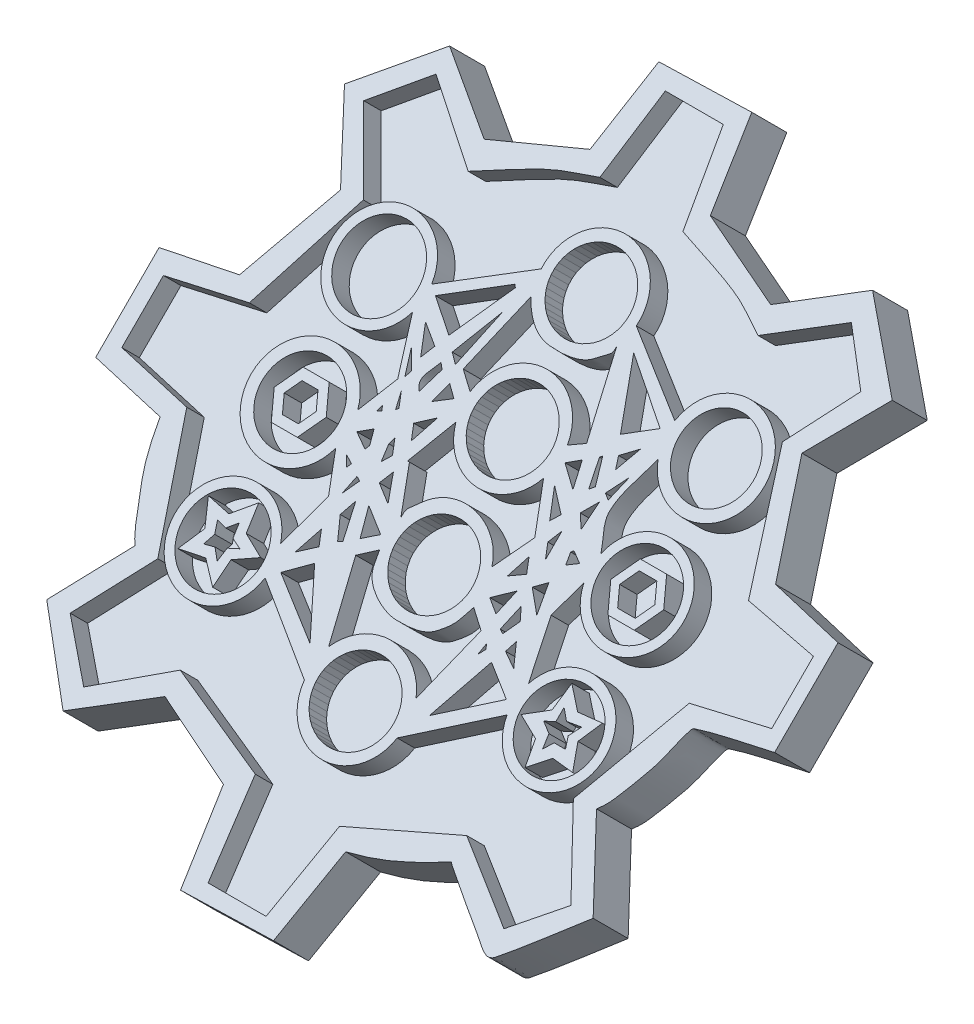
from build123d import *

# Parameters (mm, degrees)
SKETCH3_R                       = 19.05
BOSS_EXTRUDE1_DEPTH             = 6.35
BOSS_EXTRUDE2_REACH             = 37.728
SKETCH2_R                       = 5.715
BOSS_EXTRUDE2_DIRECTION_2_DEPTH = 3.175
BOSS_EXTRUDE3_DEPTH             = 3.175
SKETCH5_3_R                     = 4.970568882
SKETCH5_3_R_2                   = 4.805652839
SKETCH5_3_R_3                   = 4.855605282
SKETCH5_3_R_4                   = 4.870988111
SKETCH5_3_R_5                   = 4.809360952
SKETCH5_3_R_6                   = 5.038332607
BOSS_EXTRUDE4_DEPTH             = 6.35


with BuildPart() as part:
    # Sketch3 → Boss-Extrude1 (new body)
    with BuildSketch(Plane(origin=(0, 0, 0), x_dir=(1, 0, 0), z_dir=(0, 0.7071067811865464, 0.7071067811865488))):
        Circle(SKETCH3_R)
    extrude(amount=BOSS_EXTRUDE1_DEPTH)

    # Boss-Extrude2: up to this plane
    boss_extrude2_end = Plane(origin=(0, 0, 0), z_dir=(0, 0.7071067811865464, 0.7071067811865488))
    # Sketch2 → Boss-Extrude2 (add, up to the surface)
    with BuildSketch(Plane(origin=(0, -6.35, 0), x_dir=(1, 0, 0), z_dir=(0, 1, 0)), mode=Mode.PRIVATE) as boss_extrude2_sk1:
        Circle(SKETCH2_R)
    boss_extrude2_tool1 = split(extrude(boss_extrude2_sk1.sketch, amount=BOSS_EXTRUDE2_REACH, mode=Mode.PRIVATE), bisect_by=boss_extrude2_end, keep=Keep.BOTH, mode=Mode.PRIVATE)
    add(boss_extrude2_tool1.solids().sort_by_distance((0, -6.35, 0))[0])

    # Sketch2 → Boss-Extrude2 direction 2 (add)
    with BuildSketch(Plane(origin=(0, -6.35, 0), x_dir=(1, 0, 0), z_dir=(0, 1, 0))):
        Circle(SKETCH2_R)
    extrude(amount=-BOSS_EXTRUDE2_DIRECTION_2_DEPTH)

    # Sketch5 → Boss-Extrude3 (add)
    with BuildSketch(Plane(origin=(0, 4.490128061, 4.490128061), x_dir=(1, 0, 0), z_dir=(0, 0.7071067811865465, 0.7071067811865487))):
        with BuildLine():
            Line((5.279739912, -44.344196774), (7.279739912, -34.094196774))
            add(Edge.make_bspline(
                [(7.279739912, -34.094196774), (11.584757001, -33.233193357), (14.144722894, -32.036705283), (18.029739912, -30.094196774)],
                knots=[0, 0, 0, 0, 1, 1, 1, 1], degree=3))
            add(Edge.make_bspline(
                [(18.029739912, -30.094196774), (18.113073245, -30.177530108), (18.182843633, -30.277114735), (18.279739912, -30.344196774), (20.235461571, -31.698157923), (22.535311856, -33.297818538), (24.529739912, -34.594196774), (25.188895017, -35.022647593), (25.783918217, -35.595589543), (26.529739912, -35.844196774), (26.855700032, -35.952850148), (27.279313446, -35.829445878), (27.529739912, -35.594196774), (30.064023137, -33.213506472), (32.363073245, -30.594196774), (34.779739912, -28.094196774)],
                knots=[0, 0, 0, 0, 1, 1, 1, 2, 2, 2, 3, 3, 3, 4, 4, 4, 5, 5, 5, 5], degree=3))
            Line((34.779739912, -28.094196774), (29.029739912, -19.344196774))
            add(Edge.make_bspline(
                [(29.029739912, -19.344196774), (29.535637842, -18.838298844), (29.970385304, -18.21290599), (30.279739912, -17.594196774), (30.979938296, -16.193800005), (31.705875704, -14.800928994), (32.279739912, -13.344196774), (32.791745788, -12.044489549), (33.046816761, -10.654988184), (33.529739912, -9.344196774), (33.633611445, -9.062259756), (33.739170176, -8.670662494), (34.029739912, -8.594196774), (36.985300351, -7.816417712), (40.029739912, -7.427530108), (43.029739912, -6.844196774)],
                knots=[0, 0, 0, 0, 1, 1, 1, 2, 2, 2, 3, 3, 3, 4, 4, 4, 5, 5, 5, 5], degree=3))
            Line((43.029739912, -6.844196774), (43.029739912, 4.655803226))
            Line((43.029739912, 4.655803226), (33.779739912, 6.405803226))
            Line((33.779739912, 6.405803226), (29.029739912, 17.905803226))
            Line((29.029739912, 17.905803226), (34.779739912, 26.155803226))
            Line((34.779739912, 26.155803226), (26.779739912, 33.905803226))
            Line((26.779739912, 33.905803226), (17.779739912, 28.155803226))
            Line((17.779739912, 28.155803226), (7.029739912, 32.405803226))
            Line((7.029739912, 32.405803226), (5.279739912, 42.405803226))
            Line((5.279739912, 42.405803226), (-6.470260088, 42.155803226))
            Line((-6.470260088, 42.155803226), (-8.220260088, 32.155803226))
            Line((-8.220260088, 32.155803226), (-18.970260088, 28.155803226))
            Line((-18.970260088, 28.155803226), (-27.470260088, 33.905803226))
            Line((-27.470260088, 33.905803226), (-35.470260088, 26.155803226))
            Line((-35.470260088, 26.155803226), (-29.970260088, 17.655803226))
            Line((-29.970260088, 17.655803226), (-34.970260088, 6.405803226))
            Line((-34.970260088, 6.405803226), (-44.220260088, 4.905803226))
            Line((-44.220260088, 4.905803226), (-44.220260088, -6.594196774))
            Line((-44.220260088, -6.594196774), (-34.720260088, -8.344196774))
            add(Edge.make_bspline(
                [(-34.720260088, -8.344196774), (-34.293358408, -10.478705176), (-33.73132984, -12.69844099), (-32.720260088, -14.594196774), (-32.455227451, -15.091132969), (-30.940907357, -18.623549505), (-29.970260088, -19.594196774)],
                knots=[0, 0, 0, 0, 1, 1, 1, 2, 2, 2, 2], degree=3))
            Line((-29.970260088, -19.594196774), (-35.470260088, -27.844196774))
            Line((-35.470260088, -27.844196774), (-27.720260088, -35.844196774))
            Line((-27.720260088, -35.844196774), (-18.720260088, -30.094196774))
            Line((-18.720260088, -30.094196774), (-8.220260088, -34.344196774))
            Line((-8.220260088, -34.344196774), (-6.470260088, -44.594196774))
            Line((-6.470260088, -44.594196774), (5.279739912, -44.344196774))
        make_face()
    extrude(amount=BOSS_EXTRUDE3_DEPTH)

    # Sketch5<3> → Boss-Extrude4 (add)
    # profile 1 of 6: a face of its own
    with BuildSketch(Plane(origin=(0, 4.490128061, 4.490128061), x_dir=(1, 0, 0), z_dir=(0, 0.7071067811865465, 0.7071067811865487))):
        with BuildLine():
            Line((-6.470260088, -44.594196774), (5.279739912, -44.344196774))
            Line((5.279739912, -44.344196774), (7.279739912, -34.094196774))
            add(Edge.make_bspline(
                [(7.279739912, -34.094196774), (11.584757001, -33.233193357), (14.144722894, -32.036705283), (18.029739912, -30.094196774)],
                knots=[0, 0, 0, 0, 1, 1, 1, 1], degree=3))
            add(Edge.make_bspline(
                [(18.029739912, -30.094196774), (18.113073245, -30.177530108), (18.182843633, -30.277114735), (18.279739912, -30.344196774), (20.235461571, -31.698157923), (22.535311856, -33.297818538), (24.529739912, -34.594196774), (25.188895017, -35.022647593), (25.783918217, -35.595589543), (26.529739912, -35.844196774), (26.855700032, -35.952850148), (27.279313446, -35.829445878), (27.529739912, -35.594196774), (30.064023137, -33.213506472), (32.363073245, -30.594196774), (34.779739912, -28.094196774)],
                knots=[0, 0, 0, 0, 1, 1, 1, 2, 2, 2, 3, 3, 3, 4, 4, 4, 5, 5, 5, 5], degree=3))
            Line((34.779739912, -28.094196774), (29.029739912, -19.344196774))
            add(Edge.make_bspline(
                [(29.029739912, -19.344196774), (29.535637842, -18.838298844), (29.970385304, -18.21290599), (30.279739912, -17.594196774), (30.979938296, -16.193800005), (31.705875704, -14.800928994), (32.279739912, -13.344196774), (32.791745788, -12.044489549), (33.046816761, -10.654988184), (33.529739912, -9.344196774), (33.633611445, -9.062259756), (33.739170176, -8.670662494), (34.029739912, -8.594196774), (36.985300351, -7.816417712), (40.029739912, -7.427530108), (43.029739912, -6.844196774)],
                knots=[0, 0, 0, 0, 1, 1, 1, 2, 2, 2, 3, 3, 3, 4, 4, 4, 5, 5, 5, 5], degree=3))
            Line((43.029739912, -6.844196774), (43.029739912, 4.655803226))
            Line((43.029739912, 4.655803226), (33.779739912, 6.405803226))
            Line((33.779739912, 6.405803226), (29.029739912, 17.905803226))
            Line((29.029739912, 17.905803226), (34.779739912, 26.155803226))
            Line((34.779739912, 26.155803226), (26.779739912, 33.905803226))
            Line((26.779739912, 33.905803226), (17.779739912, 28.155803226))
            Line((17.779739912, 28.155803226), (7.029739912, 32.405803226))
            Line((7.029739912, 32.405803226), (5.279739912, 42.405803226))
            Line((5.279739912, 42.405803226), (-6.470260088, 42.155803226))
            Line((-6.470260088, 42.155803226), (-8.220260088, 32.155803226))
            Line((-8.220260088, 32.155803226), (-18.970260088, 28.155803226))
            Line((-18.970260088, 28.155803226), (-27.470260088, 33.905803226))
            Line((-27.470260088, 33.905803226), (-35.470260088, 26.155803226))
            Line((-35.470260088, 26.155803226), (-29.970260088, 17.655803226))
            Line((-29.970260088, 17.655803226), (-34.970260088, 6.405803226))
            Line((-34.970260088, 6.405803226), (-44.220260088, 4.905803226))
            Line((-44.220260088, 4.905803226), (-44.220260088, -6.594196774))
            Line((-44.220260088, -6.594196774), (-34.720260088, -8.344196774))
            add(Edge.make_bspline(
                [(-34.720260088, -8.344196774), (-34.293358408, -10.478705176), (-33.73132984, -12.69844099), (-32.720260088, -14.594196774), (-32.455227451, -15.091132969), (-30.940907357, -18.623549505), (-29.970260088, -19.594196774)],
                knots=[0, 0, 0, 0, 1, 1, 1, 2, 2, 2, 2], degree=3))
            Line((-29.970260088, -19.594196774), (-35.470260088, -27.844196774))
            Line((-35.470260088, -27.844196774), (-27.720260088, -35.844196774))
            Line((-27.720260088, -35.844196774), (-18.720260088, -30.094196774))
            Line((-18.720260088, -30.094196774), (-8.220260088, -34.344196774))
            Line((-8.220260088, -34.344196774), (-6.470260088, -44.594196774))
        make_face()
        with BuildLine():
            Line((-32.470260088, 4.655803226), (-27.220260088, 17.905803226))
            Line((-27.220260088, 17.905803226), (-32.691905174, 25.716087128))
            Line((-32.691905174, 25.716087128), (-27.220260088, 31.078479551))
            Line((-27.220260088, 31.078479551), (-18.720260088, 24.905803226))
            add(Edge.make_bspline(
                [(-18.720260088, 24.905803226), (-16.220260088, 26.155803226), (-13.794441811, 27.566726343), (-11.220260088, 28.655803226), (-9.448411749, 29.405431369), (-7.553593421, 29.822469892), (-5.720260088, 30.405803226)],
                knots=[0, 0, 0, 0, 1, 1, 1, 2, 2, 2, 2], degree=3))
            Line((-5.720260088, 30.405803226), (-4.220260088, 40.155803226))
            Line((-4.220260088, 40.155803226), (3.21091553, 40.155803226))
            Line((3.21091553, 40.155803226), (5.279739912, 29.905803226))
            add(Edge.make_bspline(
                [(5.279739912, 29.905803226), (8.113073245, 29.072469892), (11.005770436, 28.419368996), (13.779739912, 27.405803226), (15.354935076, 26.830251146), (16.779739912, 25.905803226), (18.279739912, 25.155803226)],
                knots=[0, 0, 0, 0, 1, 1, 1, 2, 2, 2, 2], degree=3))
            Line((18.279739912, 25.155803226), (26.529739912, 30.405803226))
            Line((26.529739912, 30.405803226), (31.279739912, 25.405803226))
            Line((31.279739912, 25.405803226), (26.529739912, 17.905803226))
            Line((26.529739912, 17.905803226), (32.081860477, 3.905803226))
            Line((32.081860477, 3.905803226), (41.422642886, 2.468759778))
            Line((41.422642886, 2.468759778), (41.422642886, -5.094196774))
            Line((41.422642886, -5.094196774), (32.081860477, -6.844196774))
            Line((32.081860477, -6.844196774), (26.231032843, -19.594196774))
            Line((26.231032843, -19.594196774), (31.928072177, -28.094196774))
            Line((31.928072177, -28.094196774), (26.779739912, -32.958154583))
            Line((26.779739912, -32.958154583), (18.029739912, -27.324848043))
            Line((18.029739912, -27.324848043), (5.279739912, -32.365174947))
            Line((5.279739912, -32.365174947), (3.21091553, -42.772938538))
            Line((3.21091553, -42.772938538), (-4.220260088, -42.772938538))
            Line((-4.220260088, -42.772938538), (-5.720260088, -32.094196774))
            Line((-5.720260088, -32.094196774), (-18.720260088, -27.324848043))
            Line((-18.720260088, -27.324848043), (-27.064879904, -33.025161555))
            Line((-27.064879904, -33.025161555), (-32.470260088, -27.844196774))
            Line((-32.470260088, -27.844196774), (-27.064879904, -19.594196774))
            Line((-27.064879904, -19.594196774), (-32.691905174, -6.380629942))
            Line((-32.691905174, -6.380629942), (-42.253355153, -4.64239359))
            Line((-42.253355153, -4.64239359), (-42.253355153, 2.905803226))
            Line((-42.253355153, 2.905803226), (-32.470260088, 4.655803226))
        make_face(mode=Mode.SUBTRACT)
    # profile 2 of 6: a face of its own
    with BuildSketch(Plane(origin=(0, 4.490128061, 4.490128061), x_dir=(1, 0, 0), z_dir=(0, 0.7071067811865465, 0.7071067811865487))):
        with BuildLine():
            Line((-16.257456352, 11.319936659), (-13.970272194, 5.405914252))
            Line((-13.970272194, 5.405914252), (-16.08909918, 1.155803226))
            ThreePointArc((-16.08909918, 1.155803226), (-28.350944025, -0.844196774), (-16.08909918, -2.844196774))
            Line((-16.08909918, -2.844196774), (-14.101992892, -6.961107012))
            Line((-14.101992892, -6.961107012), (-16.08909918, -12.844196774))
            ThreePointArc((-16.08909918, -12.844196774), (-27.892835559, -15.997407106), (-15.677503502, -16.235294969))
            Line((-15.677503502, -16.235294969), (-6.220260088, -22.478622909))
            ThreePointArc((-6.220260088, -22.478622909), (-0.299572831, -27.939178632), (5.915431888, -22.816101165))
            Line((5.915431888, -22.816101165), (15.206738824, -16.025416492))
            ThreePointArc((15.206738824, -16.025416492), (26.975032717, -15.402291772), (15.529727806, -12.594085748))
            Line((15.529727806, -12.594085748), (13.905315183, -6.192741522))
            Line((13.905315183, -6.192741522), (15.262165726, -2.175606861))
            ThreePointArc((15.262165726, -2.175606861), (27.020758207, -0.701810351), (15.279727806, 0.905914252))
            add(Edge.make_bspline(
                [(15.279727806, 0.905914252), (14.770268347, 2.162671009), (13.717457708, 3.320515743), (13.751349428, 4.676184522), (13.805320836, 6.835040854), (14.936935013, 8.829337675), (15.529727806, 10.905914252)],
                knots=[0, 0, 0, 0, 1, 1, 1, 2, 2, 2, 2], degree=3))
            ThreePointArc((15.529727806, 10.905914252), (27.215088138, 14.463661756), (15.002171576, 14.687005548))
            Line((15.002171576, 14.687005548), (6.029727806, 20.392092236))
            ThreePointArc((6.029727806, 20.392092236), (-0.03911438, 27.12077975), (-6.28230666, 20.553540504))
            Line((-6.28230666, 20.553540504), (-15.970272194, 14.388538455))
            ThreePointArc((-15.970272194, 14.388538455), (-28.099749615, 13.975972021), (-16.257456352, 11.319936659))
        make_face()
        Polygon((4.780880091, 21.032755153), (4.752003505, 20.392092236), (4.636184523, 19.761323821), (4.435489938, 19.151705984), (4.15350115, 18.574117371), (3.795250255, 18.038865065), (3.367130249, 17.555500654), (2.876780943, 17.132649789), (2.332952633, 16.777858254), (1.745349947, 16.497457311), (1.12445867, 16.296450722), (0.481358621, 16.178425454), (-0.172474065, 16.145487671), (-0.825371727, 16.19822515), (-1.465683392, 16.335696787), (-2.081982682, 16.555449398), (-2.663271723, 16.853561494), (-3.199177396, 17.224713256), (-3.680136454, 17.662281472), (-4.09756617, 18.158457728), (-4.444017501, 18.704387746), (-4.713308015, 19.290329392), (-4.900632216, 19.905826524), (-5.0026473, 20.539895581), (-5.017532804, 21.181221585), (-4.945023097, 21.818360058), (-4.786412116, 22.43994125), (-4.544530278, 23.03487303), (-4.22369397, 23.592538825), (-3.829628524, 24.102987076), (-3.369366046, 24.557108823), (-2.851119931, 24.946800251), (-2.284138295, 25.265107309), (-1.678538936, 25.506349799), (-1.045128791, 25.666222743), (-0.395211079, 25.741873205), (0.259616404, 25.7319512), (0.907668246, 25.636633787), (1.537379946, 25.457621907), (2.137514285, 25.198110032), (2.697361849, 24.862729157), (3.206932147, 24.457464162), (3.657131885, 23.98954701), (4.039927237, 23.467327694), (4.348487211, 22.90012523), (4.577305548, 22.298061359), (4.722298978, 21.671879926), align=None, mode=Mode.SUBTRACT)
        Polygon((-7.720260088, 17.905803226), (-11.470260088, 11.155803226), (-14.970260088, 13.655803226), (-7.970260088, 18.155803226), align=None, mode=Mode.SUBTRACT)
        with BuildLine():
            Line((14.029739912, 13.405803226), (10.529739912, 11.155803226))
            Line((10.529739912, 11.155803226), (7.279739912, 18.155803226))
            Line((7.279739912, 18.155803226), (10.388781683, 15.967959016))
            ThreePointArc((10.388781683, 15.967959016), (10.963149388, 15.579212288), (11.522985588, 15.169815527))
            Line((11.522985588, 15.169815527), (14.029739912, 13.405803226))
        make_face(mode=Mode.SUBTRACT)
        with Locations((-22.008604801, 13.405914252)):
            Circle(SKETCH5_3_R, mode=Mode.SUBTRACT)
        with Locations((21.090961569, 13.60919386)):
            Circle(SKETCH5_3_R_2, mode=Mode.SUBTRACT)
        with BuildLine():
            Line((7.779739912, 8.905803226), (6.029739912, 7.905803226))
            ThreePointArc((6.029739912, 7.905803226), (-0.226760238, 12.939651053), (-6.303220633, 7.689884664))
            Line((-6.303220633, 7.689884664), (-8.220260088, 9.155803226))
            Line((-8.220260088, 9.155803226), (-5.720260088, 17.905803226))
            add(Edge.make_bspline(
                [(-5.720260088, 17.905803226), (-4.676789746, 16.340597712), (-3.272029723, 15.076784028), (-1.220260088, 14.905803226), (0.080290366, 14.797424021), (2.532749715, 14.783512048), (3.779739912, 15.905803226), (5.333972526, 17.304612579), (5.279739912, 16.932462573), (5.279739912, 17.905803226)],
                knots=[0, 0, 0, 0, 1, 1, 1, 2, 2, 2, 3, 3, 3, 3], degree=3))
            Line((5.279739912, 17.905803226), (7.779739912, 8.905803226))
        make_face(mode=Mode.SUBTRACT)
        with Locations((21.04483201, -0.667752596)):
            Circle(SKETCH5_3_R_3, mode=Mode.SUBTRACT)
        Polygon((10.779739912, -12.594196774), (14.279739912, -14.844196774), (7.779739912, -19.594196774), align=None, mode=Mode.SUBTRACT)
        with BuildLine():
            Line((8.029739912, -10.594196774), (5.529739912, -18.844196774))
            ThreePointArc((5.529739912, -18.844196774), (-0.082726229, -15.423475987), (-5.744399475, -18.76212286))
            Line((-5.744399475, -18.76212286), (-8.220260088, -10.344196774))
            Line((-8.220260088, -10.344196774), (-6.220260088, -8.844196774))
            add(Edge.make_bspline(
                [(-6.220260088, -8.844196774), (-6.053593421, -9.510863441), (-6.004618963, -10.21860725), (-5.720260088, -10.844196774), (-4.988331336, -12.454440028), (-2.333058465, -13.594196774), (-0.720260088, -13.594196774), (0.62494941, -13.594196774), (2.610311232, -13.646682586), (3.779739912, -12.594196774), (5.336851889, -11.192795995), (5.271092855, -10.86437324), (6.029739912, -9.094196774)],
                knots=[0, 0, 0, 0, 1, 1, 1, 2, 2, 2, 3, 3, 3, 4, 4, 4, 4], degree=3))
            Line((6.029739912, -9.094196774), (8.029739912, -10.594196774))
        make_face(mode=Mode.SUBTRACT)
        Polygon((-11.720260088, -12.844196774), (-7.720260088, -19.344196774), (-14.470260088, -15.094196774), align=None, mode=Mode.SUBTRACT)
        Polygon((-12.220260088, -11.344196774), (-14.220260088, -12.844196774), (-12.970260088, -9.844196774), align=None, mode=Mode.SUBTRACT)
        with Locations((-22.056914009, -0.844196774)):
            Circle(SKETCH5_3_R_4, mode=Mode.SUBTRACT)
        Polygon((-12.970260088, -6.094196774), (-12.470260088, -4.094196774), (-11.970260088, -4.344196774), align=None, mode=Mode.SUBTRACT)
        Polygon((-13.970260088, -3.844196774), (-14.720260088, -2.844196774), (-13.720260088, -3.344196774), align=None, mode=Mode.SUBTRACT)
        Polygon((-11.220260088, -6.094196774), (-10.220260088, -9.844196774), (-10.720260088, -10.094196774), (-11.970260088, -7.844196774), align=None, mode=Mode.SUBTRACT)
        Polygon((-8.720260088, -8.844196774), (-9.720260088, -5.844196774), (-6.970260088, -7.594196774), align=None, mode=Mode.SUBTRACT)
        Polygon((-9.970260088, -3.594196774), (-9.220260088, -2.094196774), (-7.970260088, -4.844196774), align=None, mode=Mode.SUBTRACT)
        Polygon((9.529739912, -11.844196774), (9.029739912, -12.594196774), (9.279739912, -11.344196774), align=None, mode=Mode.SUBTRACT)
        Polygon((4.762755279, -7.215070173), (4.765926216, -7.857175025), (4.681665837, -8.493735221), (4.51147777, -9.113391331), (4.258399024, -9.705085577), (3.926945795, -10.258259159), (3.523032875, -10.763040683), (3.0538681, -11.210422311), (2.527823725, -11.592420506), (1.954287024, -11.902218502), (1.343492775, -12.134287947), (0.706340615, -12.284487554), (0.054200539, -12.35013701), (-0.601289998, -12.330064798), (-1.248433751, -12.224629107), (-1.875682425, -12.035711439), (-2.471842753, -11.766683034), (-3.026276239, -11.422344712), (-3.529089004, -11.008841197), (-3.971308343, -10.533551469), (-4.345042842, -10.004957085), (-4.643623199, -9.432490824), (-4.861721241, -8.826368361), (-4.995445003, -8.197405964), (-5.042408181, -7.556827484), (-5.001772716, -6.916064057), (-4.87426375, -6.286550122), (-4.662156682, -5.679519371), (-4.369236569, -5.105804282), (-4.000730576, -4.575642814), (-3.563214702, -4.09849571), (-3.064496428, -3.682877673), (-2.513475394, -3.336205417), (-1.919984582, -3.064665314), (-1.294614851, -2.873103006), (-0.648525938, -2.764936927), (0.006752685, -2.742097301), (0.659527556, -2.804991704), (1.298149891, -2.952497783), (1.911223459, -3.181983288), (2.487807949, -3.489353045), (3.017614197, -3.869122034), (3.491187796, -4.314513268), (3.900077816, -4.81757873), (4.236987605, -5.369341205), (4.495904998, -5.959954478), (4.672209609, -6.578879042), align=None, mode=Mode.SUBTRACT)
        Polygon((7.029739912, -7.594196774), (9.279739912, -5.844196774), (8.529739912, -8.594196774), align=None, mode=Mode.SUBTRACT)
        Polygon((7.529739912, -5.094196774), (8.529739912, -2.594196774), (9.279739912, -4.094196774), align=None, mode=Mode.SUBTRACT)
        Polygon((11.529739912, -11.094196774), (12.029739912, -9.844196774), (13.279739912, -12.094196774), align=None, mode=Mode.SUBTRACT)
        Polygon((10.529739912, -6.844196774), (11.279739912, -8.094196774), (10.279739912, -9.844196774), (9.779739912, -9.594196774), align=None, mode=Mode.SUBTRACT)
        Polygon((12.529739912, -6.844196774), (10.529735594, -4.844191493), (11.882176005, -3.738428519), align=None, mode=Mode.SUBTRACT)
        Polygon((-13.470260088, 0.405803226), (-12.970260088, -1.094196774), (-13.220260088, -1.594196774), (-14.970260088, -0.594196774), align=None, mode=Mode.SUBTRACT)
        Polygon((-14.220260088, 1.905803226), (-13.970260088, 2.655803226), (-13.720260088, 2.155803226), align=None, mode=Mode.SUBTRACT)
        Polygon((-12.470260088, 2.905803226), (-12.970260088, 4.655803226), (-12.220260088, 3.155803226), align=None, mode=Mode.SUBTRACT)
        Polygon((-13.406727352, 5.905803226), (-14.470260088, 8.655803226), (-13.078755462, 6.671070967), align=None, mode=Mode.SUBTRACT)
        Polygon((-12.970260088, 8.155803226), (-14.470260088, 11.155803226), (-12.220260088, 9.655803226), align=None, mode=Mode.SUBTRACT)
        Polygon((-10.970260088, 0.655803226), (-10.220260088, -0.844196774), (-10.970260088, -1.844196774), (-11.220260088, -0.094196774), align=None, mode=Mode.SUBTRACT)
        Polygon((-9.970260088, 2.655803226), (-7.970260088, 4.155803226), (-9.220260088, 1.155803226), align=None, mode=Mode.SUBTRACT)
        with BuildLine():
            add(Edge.make_bspline(
                [(-11.220260088, 5.405803226), (-12.29795056, 6.483493698), (-11.299531821, 7.352441827), (-10.720260088, 8.655803226)],
                knots=[0, 0, 0, 0, 1, 1, 1, 1], degree=3))
            Line((-10.720260088, 8.655803226), (-10.220260088, 8.155803226))
            Line((-10.220260088, 8.155803226), (-11.220260088, 5.405803226))
        make_face(mode=Mode.SUBTRACT)
        Polygon((-9.470260088, 5.155803226), (-8.720260088, 7.405803226), (-7.470260088, 6.405803226), align=None, mode=Mode.SUBTRACT)
        Polygon((-10.220260088, 9.984405042), (-7.608527414, 15.390030667), (-9.220260088, 9.155803226), align=None, mode=Mode.SUBTRACT)
        with BuildLine():
            ThreePointArc((-5.970260088, 4.655803226), (-0.347338087, 0.4848968), (5.570169903, 4.226128071))
            Line((5.570169903, 4.226128071), (8.029739912, -0.844196774))
            Line((8.029739912, -0.844196774), (5.529739912, -5.094196774))
            add(Edge.make_bspline(
                [(5.529739912, -5.094196774), (3.999494198, -1.268582489), (-1.778412183, 0.115091849), (-4.720260088, -3.094196774), (-6.014426666, -4.50601486), (-5.970260088, -4.377869475), (-5.970260088, -5.344196774)],
                knots=[0, 0, 0, 0, 1, 1, 1, 2, 2, 2, 2], degree=3))
            Line((-5.970260088, -5.344196774), (-8.220260088, -0.594196774))
            Line((-8.220260088, -0.594196774), (-8.470260088, -0.594196774))
            Line((-8.470260088, -0.594196774), (-5.970260088, 4.655803226))
        make_face(mode=Mode.SUBTRACT)
        Polygon((9.529739912, -0.594196774), (10.279739912, 0.905803226), (10.279739912, -2.094196774), align=None, mode=Mode.SUBTRACT)
        Polygon((8.529739912, 1.155803226), (7.029739912, 4.155803226), (9.279739912, 2.155803226), align=None, mode=Mode.SUBTRACT)
        Polygon((4.768920607, 7.136506875), (4.789627217, 6.494341741), (4.722774709, 5.855330345), (4.569556067, 5.23087586), (4.33270548, 4.632121691), (4.016449554, 4.069752619), (3.626431882, 3.553804136), (3.16961234, 3.093483352), (2.654142883, 2.697004705), (2.089222075, 2.371443364), (1.484930942, 2.122608979), (0.852053073, 1.954942007), (0.20188219, 1.871434467), (-0.453979394, 1.873576555), (-1.103827813, 1.961330044), (-1.736066506, 2.133128971), (-2.339413159, 2.385907581), (-2.903101036, 2.715155033), (-3.417071115, 3.114995898), (-3.872151586, 3.578295008), (-4.260221529, 4.096784777), (-4.574355825, 4.661212745), (-4.80894874, 5.26150668), (-4.95981396, 5.886954323), (-5.024259289, 6.526394547), (-5.001134701, 7.168416524), (-4.890852853, 7.801563359), (-4.695381727, 8.41453653), (-4.418209512, 8.996397516), (-4.06428235, 9.536762995), (-3.639916082, 10.025990132), (-3.152683533, 10.455348658), (-2.611279379, 10.817176658), (-2.025364991, 11.105017303), (-1.405396024, 11.313734072), (-0.76243584, 11.439602407), (-0.107958078, 11.480376186), (0.546358091, 11.435327799), (1.188836379, 11.305261136), (1.808011746, 11.09249724), (2.392834992, 10.800832888), (2.932869934, 10.435472836), (3.418479634, 10.002936943), (3.840998376, 9.510943823), (4.192886304, 8.968273105), (4.467863968, 8.38460876), (4.661024387, 7.770366293), align=None, mode=Mode.SUBTRACT)
        Polygon((6.779739912, 6.405803226), (8.279739912, 7.405803226), (9.029739912, 4.655803226), align=None, mode=Mode.SUBTRACT)
        Polygon((12.529739912, -0.094196774), (13.779739912, -0.844196774), (12.529739912, -1.594196774), (12.279739912, -0.344196774), align=None, mode=Mode.SUBTRACT)
        Polygon((11.029739912, 3.155803226), (12.279739912, 4.905803226), (12.029739912, 1.905803226), align=None, mode=Mode.SUBTRACT)
        Polygon((10.029739912, 8.655803226), (11.029739912, 5.905803226), (10.529739912, 5.405803226), (9.779739912, 8.405803226), align=None, mode=Mode.SUBTRACT)
        Polygon((12.344515936, 5.853367658), (13.779739912, 8.155803226), (13.001299698, 5.443961281), align=None, mode=Mode.SUBTRACT)
        Polygon((12.029739912, 8.155803226), (11.529739912, 9.405803226), (13.279739912, 10.905803226), align=None, mode=Mode.SUBTRACT)
        with Locations((21.04483201, -14.844085748)):
            Circle(SKETCH5_3_R_5, mode=Mode.SUBTRACT)
        Polygon((-4.212419142, -19.100498899), (-3.820918442, -18.602736611), (-3.366252294, -18.159927311), (-2.856200163, -17.77964759), (-2.299489182, -17.468404139), (-1.705644829, -17.23152242), (-1.084827948, -17.073055545), (-0.447660885, -16.995714925), (0.194954252, -17.000823881), (0.832022142, -17.088294996), (1.452642376, -17.256631616), (2.04619597, -17.502953455), (2.602527056, -17.823045877), (3.112116657, -18.211432012), (3.566245553, -18.661466466), (3.957143471, -19.165449025), (4.278122042, -19.714756408), (4.523689232, -20.299989811), (4.689643318, -20.911135731), (4.77314478, -21.537737291), (4.772764886, -22.169073164), (4.688510134, -22.794341018), (4.521822148, -23.402842348), (4.275553004, -23.984165526), (3.953916437, -24.528363953), (3.562415737, -25.026126241), (3.107749589, -25.468935541), (2.597697458, -25.849215262), (2.040986477, -26.160458713), (1.447142124, -26.397340432), (0.826325242, -26.555807307), (0.18915818, -26.633147927), (-0.453456958, -26.628038971), (-1.090524847, -26.540567856), (-1.711145081, -26.372231236), (-2.304698675, -26.125909397), (-2.861029762, -25.805816975), (-3.370619362, -25.41743084), (-3.824748258, -24.967396386), (-4.215646177, -24.463413827), (-4.536624747, -23.914106445), (-4.782191937, -23.328873041), (-4.948146023, -22.717727121), (-5.031647485, -22.091125561), (-5.031267591, -21.459789688), (-4.947012839, -20.834521834), (-4.780324853, -20.226020504), (-4.534055709, -19.644697326), align=None, mode=Mode.SUBTRACT)
        with Locations((-21.7683766, -15.25404885)):
            Circle(SKETCH5_3_R_6, mode=Mode.SUBTRACT)
    # profile 3 of 6: a face of its own
    with BuildSketch(Plane(origin=(0, 4.490128061, 4.490128061), x_dir=(1, 0, 0), z_dir=(0, 0.7071067811865465, 0.7071067811865487))):
        Polygon((-22.718309117, -12.844196774), (-25.700297596, -12.343125848), (-24.209303357, -15.094196774), (-25.700297596, -17.890406739), (-22.500579241, -17.357120346), (-20.208703122, -19.344196774), (-19.960829851, -16.35179973), (-17.231474557, -14.8372544), (-19.960829851, -13.596164103), (-20.456576393, -10.621684849), align=None)
        Polygon((-21.218839858, -17.088294996), (-22.209375636, -16.080279175), (-23.470004565, -16.35179973), (-22.952720012, -15.094196774), (-23.470004565, -13.843674359), (-22.238346387, -14.097077716), (-21.218839858, -13.09525049), (-20.971329602, -14.580312025), (-19.721992121, -15.094196774), (-20.971329602, -15.615304464), align=None, mode=Mode.SUBTRACT)
    # profile 4 of 6: a face of its own
    with BuildSketch(Plane(origin=(0, 4.490128061, 4.490128061), x_dir=(1, 0, 0), z_dir=(0, 0.7071067811865465, 0.7071067811865487))):
        Polygon((23.490868276, -14.888062717), (24.847878751, -12.343125848), (21.832832921, -12.594085748), (19.672355363, -10.594196774), (19.258723564, -13.595963939), (16.532569881, -15.354750619), (19.258723564, -16.594385082), (19.850991741, -19.344196774), (22.013553128, -17.357120346), (24.718492812, -17.581182273), align=None)
        Polygon((20.272317807, -14.347731104), (20.272317807, -12.844196774), (21.287163932, -13.837781258), (23.054863814, -13.595963939), (22.246776309, -14.888062717), (22.739942325, -16.080279175), (21.287163932, -16.080279175), (20.521279129, -17.088294996), (20.272317807, -15.594527065), (19.07239292, -14.844085748), align=None, mode=Mode.SUBTRACT)
    # profile 5 of 6: a face of its own
    with BuildSketch(Plane(origin=(0, 4.490128061, 4.490128061), x_dir=(1, 0, 0), z_dir=(0, 0.7071067811865465, 0.7071067811865487))):
        Polygon((-20.388587049, -3.733823834), (-18.720260088, -0.844196774), (-20.388587049, 2.045430285), (-23.72524097, 2.045430285), (-25.39356793, -0.844196774), (-23.72524097, -3.733823834), align=None)
        Polygon((-21.029997249, 0.934475229), (-20.003080489, -0.844196774), (-21.029997249, -2.622868778), (-23.083830769, -2.622868778), (-24.11074753, -0.844196774), (-23.083830769, 0.934475229), align=None, mode=Mode.SUBTRACT)
    # profile 6 of 6: a face of its own
    with BuildSketch(Plane(origin=(0, 4.490128061, 4.490128061), x_dir=(1, 0, 0), z_dir=(0, 0.7071067811865465, 0.7071067811865487))):
        Polygon((17.654611382, -0.667752596), (19.349721696, -3.603769785), (22.739942325, -3.603769785), (24.435052639, -0.667752596), (22.739942325, 2.268264592), (19.349721696, 2.268264592), align=None)
        Polygon((18.784805625, -0.667752596), (19.914818818, 1.289487666), (22.174845203, 1.289487666), (23.304858395, -0.667752596), (22.174845203, -2.624992859), (19.914818818, -2.624992859), align=None, mode=Mode.SUBTRACT)
    extrude(amount=BOSS_EXTRUDE4_DEPTH)


solid = part.part
